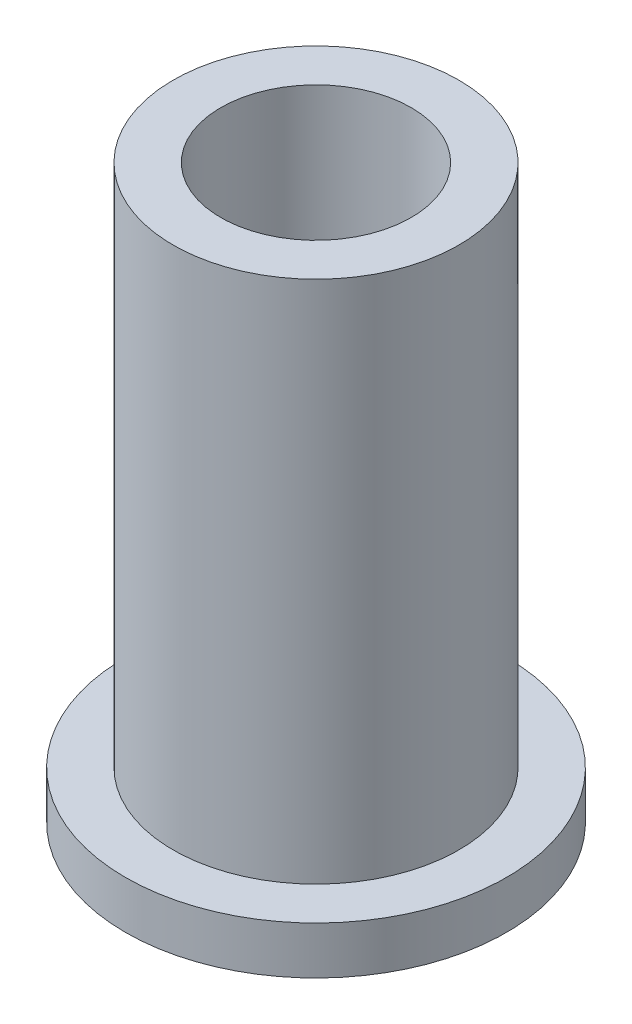
from build123d import *


with BuildPart() as part:
    # Sketch1 → Revolve1 (revolve)
    with BuildSketch(Plane.XY):
        Polygon((3.175, 0), (6.35, 0), (6.35, 1.5875), (4.7625, 1.5875), (4.7625, 19.05), (3.175, 19.05), align=None)
    revolve(axis=Axis((0, 0, 0), (0, 1, 0)))


solid = part.part
